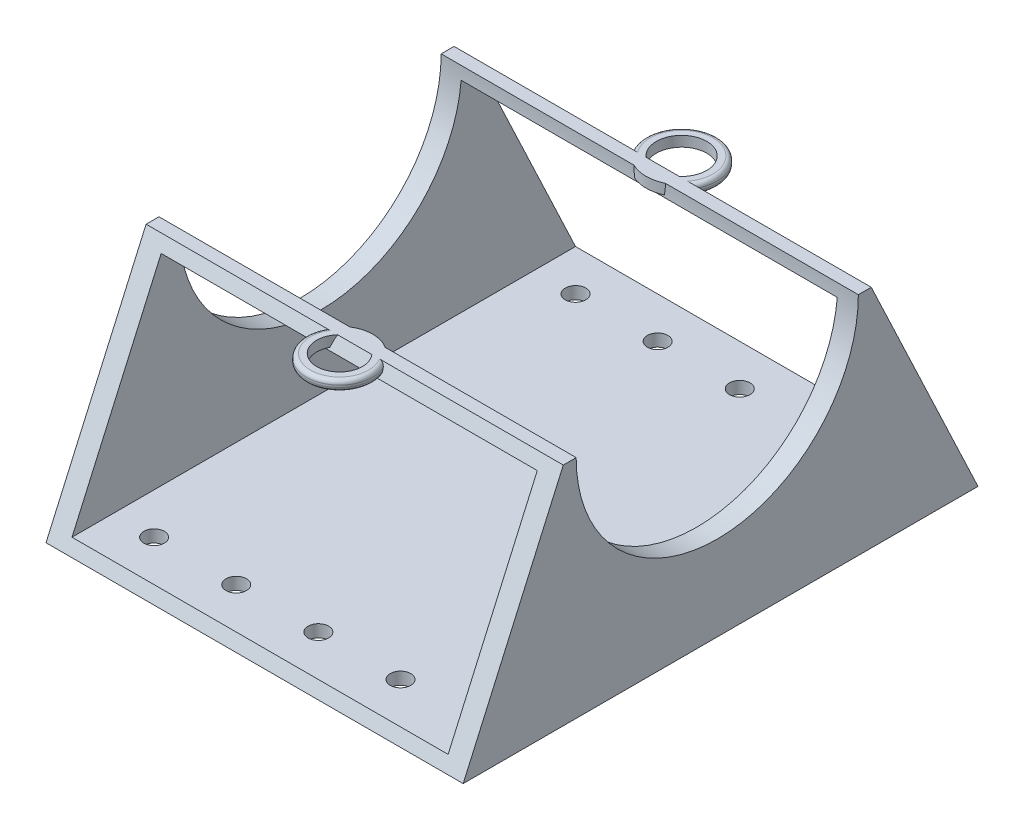
from build123d import *

# Parameters (mm, degrees)
SKETCH3_W               = 101.6
SKETCH3_H               = 75
BOSS_EXTRUDE2_DEPTH     = 55
CUT_EXTRUDE2_DEPTH      = 122.465262524
CUT_EXTRUDE2_DEPTH_BACK = 122.465262524
SKETCH4_R               = 34.361552214
BOSS_EXTRUDE4_DEPTH     = 101.6
BOSS_EXTRUDE5_DEPTH     = 101.6
CUT_EXTRUDE3_DEPTH      = 125.423596536
CUT_EXTRUDE3_DEPTH_BACK = 125.423596536
SKETCH9_W               = 91.6
SKETCH9_H               = 49
SKETCH11_R              = 8.637348936
SKETCH11_R_2            = 6.137348936
BOSS_EXTRUDE6_DEPTH     = 2.5
FILLET2_R               = 1
BOSS_EXTRUDE7_START     = -2.5
BOSS_EXTRUDE7_DEPTH     = 2.5
FILLET3_R               = 1
CUT_EXTRUDE4_START      = -10
SKETCH13_R              = 2.5
CUT_EXTRUDE4_DEPTH      = 12.5
CUT_EXTRUDE5_START      = -7.5
SKETCH14_R              = 2.5
CUT_EXTRUDE5_DEPTH      = 10
LPATTERN2_COUNT         = 4
LPATTERN2_PITCH         = 20
LPATTERN3_COUNT         = 4
LPATTERN3_PITCH         = 20


with BuildPart() as part:
    # Sketch3 → Boss-Extrude2 (new body)
    with BuildSketch(Plane(origin=(0, 0, 0), x_dir=(1, 0, 0), z_dir=(0, 1, 0))):
        Rectangle(SKETCH3_W, SKETCH3_H)
    extrude(amount=BOSS_EXTRUDE2_DEPTH)

    # Sketch4 → Cut-Extrude2 (cut, two sides: drawn at the far end of the back side and taken through both)
    with BuildSketch(Plane(origin=(50.8, 0, 0), x_dir=(0, 0, -1), z_dir=(1, 0, 0)).offset(-CUT_EXTRUDE2_DEPTH_BACK)):
        with Locations((0, 55)):
            Circle(SKETCH4_R)
    extrude(amount=CUT_EXTRUDE2_DEPTH + CUT_EXTRUDE2_DEPTH_BACK, mode=Mode.SUBTRACT)

    # Sketch7 → Boss-Extrude4 (add)
    with BuildSketch(Plane.ZY.offset(50.8)):
        Polygon((-37.5, 55), (-63.5, 0), (-37.5, 0), align=None)
    extrude(amount=-BOSS_EXTRUDE4_DEPTH)

    # Sketch8 → Boss-Extrude5 (add)
    with BuildSketch(Plane.ZY.offset(50.8)):
        Polygon((37.5, 55), (61.876010058, 0), (37.5, 0), align=None)
    extrude(amount=-BOSS_EXTRUDE5_DEPTH)

    # Sketch9 → Cut-Extrude3 (cut, two sides: drawn at the far end of the back side and taken through both)
    with BuildSketch(Plane(origin=(0, 0, -37.5), x_dir=(-1, 0, 0), z_dir=(0, 0, -1)).offset(-CUT_EXTRUDE3_DEPTH_BACK)):
        with Locations((0, 27.5)):
            Rectangle(SKETCH9_W, SKETCH9_H)
    extrude(amount=CUT_EXTRUDE3_DEPTH + CUT_EXTRUDE3_DEPTH_BACK, mode=Mode.SUBTRACT)

    # Sketch11 → Boss-Extrude6 (add)
    with BuildSketch(Plane(origin=(0, 55, 0), x_dir=(1, 0, 0), z_dir=(0, 1, 0))):
        with Locations((0, 42.107585669)):
            Circle(SKETCH11_R)
        with Locations((0, 42.107585669)):
            Circle(SKETCH11_R_2, mode=Mode.SUBTRACT)
    extrude(amount=-BOSS_EXTRUDE6_DEPTH)

    # Fillet2
    # the kernel refuses this fillet: 1 mm, written as the material it takes off along each edge
    with BuildSketch(Plane(origin=(0, 52.5, -42.107585669), x_dir=(0.7661198217735417, 0, 0.6426977662056067), z_dir=(-0.6426977662056067, 0, 0.7661198217735417))) as fillet2_piece_1_section:
        with BuildLine():
            CenterArc((8.637348936 - FILLET2_R, FILLET2_R), FILLET2_R, 270, 90)
            Line((8.637348936, FILLET2_R), (8.637348936, 0))
            Line((8.637348936, 0), (8.637348936 - FILLET2_R, 0))
        make_face()
    fillet2_piece_1 = revolve(axis=Axis((0, 52.5, -42.107585669), (0, 1, 0)), revolution_arc=259.986561096, mode=Mode.PRIVATE)
    fillet2_piece_1 = split(fillet2_piece_1, bisect_by=Plane(origin=(0, 51.176344905, -39.307546045), z_dir=(0, 0.42737961689341614, -0.9040722665053037)), keep=Keep.TOP, mode=Mode.PRIVATE)
    add(fillet2_piece_1, mode=Mode.SUBTRACT)
    with BuildSketch(Plane(origin=(0, 55, -42.107585669), x_dir=(0.6577465140217427, 0, 0.753239353255156), z_dir=(-0.753239353255156, 0, 0.6577465140217427))) as fillet2_piece_2_section:
        with BuildLine():
            CenterArc((8.637348936 - FILLET2_R, -FILLET2_R), FILLET2_R, 0, 90)
            Line((8.637348936 - FILLET2_R, 0), (8.637348936, 0))
            Line((8.637348936, 0), (8.637348936, -FILLET2_R))
        make_face()
    fillet2_piece_2 = revolve(axis=Axis((0, 55, -42.107585669), (0, 1, 0)), revolution_arc=277.743530493, mode=Mode.PRIVATE)
    fillet2_piece_2 = split(fillet2_piece_2, bisect_by=Plane(origin=(0, 53.219711563, -38.341590898), z_dir=(0, 0.42737961689341614, -0.9040722665053037)), keep=Keep.TOP, mode=Mode.PRIVATE)
    add(fillet2_piece_2, mode=Mode.SUBTRACT)

    # Boss-Extrude7: read off the stored shape, not the designer's step
    # Boss-Extrude7 outline → Boss-Extrude7 (add)
    with BuildSketch(Plane(origin=(0, 55, 0), x_dir=(1, 0, 0), z_dir=(0, 1, 0)).offset(BOSS_EXTRUDE7_START)):
        with BuildLine():
            Line((-50.8, -34.361552214), (-50.8, -37.5))
            Line((-50.8, -37.5), (-7.182675213, -37.5))
            ThreePointArc((-7.182675213, -37.5), (0, -49.257807046), (7.182675213, -37.5))
            Line((7.182675213, -37.5), (50.8, -37.5))
            Line((50.8, -37.5), (50.8, -34.361552214))
            Line((50.8, -34.361552214), (4.313996334, -34.361552214))
            ThreePointArc((4.313996334, -34.361552214), (0, -33.11220702), (-4.313996334, -34.361552214))
            Line((-4.313996334, -34.361552214), (-50.8, -34.361552214))
        make_face()
        with BuildLine():
            ThreePointArc((4.180529051, -37.5), (0, -46.757807046), (-4.180529051, -37.5))
            Line((-4.180529051, -37.5), (4.180529051, -37.5))
        make_face(mode=Mode.SUBTRACT)
    extrude(amount=BOSS_EXTRUDE7_DEPTH)

    # Fillet3
    # the kernel refuses this fillet: 1 mm, written as the material it takes off along each edge
    with BuildSketch(Plane(origin=(0, 52.5, 41.185007033), x_dir=(-0.8048848647873229, 0, -0.5934310022540891), z_dir=(0.5934310022540891, 0, -0.8048848647873229))) as fillet3_piece_1_section:
        with BuildLine():
            CenterArc((8.072800013 - FILLET3_R, FILLET3_R), FILLET3_R, 270, 90)
            Line((8.072800013 - FILLET3_R, 0), (8.072800013, 0))
            Line((8.072800013, 0), (8.072800013, FILLET3_R))
        make_face()
    fillet3_piece_1 = revolve(axis=Axis((0, 52.5, 41.185007033), (0, 1, 0)), revolution_arc=252.801724897, mode=Mode.PRIVATE)
    fillet3_piece_1 = split(fillet3_piece_1, bisect_by=Plane(origin=(0, 51.545382329, 39.031087184), z_dir=(0, 0.4051883376708072, 0.9142332366609561)), keep=Keep.TOP, mode=Mode.PRIVATE)
    add(fillet3_piece_1, mode=Mode.SUBTRACT)
    with BuildSketch(Plane(origin=(0, 55, 41.185007033), x_dir=(-0.7077045492924725, 0, -0.7065085073166059), z_dir=(0.7065085073166059, 0, -0.7077045492924725))) as fillet3_piece_2_section:
        with BuildLine():
            CenterArc((8.072800013 - FILLET3_R, -FILLET3_R), FILLET3_R, 0, 90)
            Line((8.072800013, -FILLET3_R), (8.072800013, 0))
            Line((8.072800013, 0), (8.072800013 - FILLET3_R, 0))
        make_face()
    fillet3_piece_2 = revolve(axis=Axis((0, 55, 41.185007033), (0, 1, 0)), revolution_arc=269.903086539, mode=Mode.PRIVATE)
    fillet3_piece_2 = split(fillet3_piece_2, bisect_by=Plane(origin=(0, 53.634938356, 38.10499557), z_dir=(0, 0.4051883376708072, 0.9142332366609561)), keep=Keep.TOP, mode=Mode.PRIVATE)
    add(fillet3_piece_2, mode=Mode.SUBTRACT)

    # Sketch13 → Cut-Extrude4 (cut)
    with BuildSketch(Plane(origin=(0, 3, 0), x_dir=(1, 0, 0), z_dir=(0, 1, 0)).offset(CUT_EXTRUDE4_START)):
        with Locations(Location((-35.8, -50.546409509, 0), (0, 0, 90))):
            Circle(SKETCH13_R)
    cut_extrude4 = extrude(amount=CUT_EXTRUDE4_DEPTH, mode=Mode.SUBTRACT)

    # Sketch14 → Cut-Extrude5 (cut)
    with BuildSketch(Plane(origin=(0, 3, 0), x_dir=(1, 0, 0), z_dir=(0, 1, 0)).offset(CUT_EXTRUDE5_START)):
        with Locations(Location((-35.8, 52.081818182, 0), (0, 0, 90))):
            Circle(SKETCH14_R)
    cut_extrude5 = extrude(amount=CUT_EXTRUDE5_DEPTH, mode=Mode.SUBTRACT)

    # LPattern2: Cut-Extrude4 ×4
    with Locations(*[(i * LPATTERN2_PITCH, 0, 0) for i in range(1, LPATTERN2_COUNT)]):
        add(cut_extrude4, mode=Mode.SUBTRACT)

    # LPattern3: Cut-Extrude5 ×4
    with Locations(*[(i * LPATTERN3_PITCH, 0, 0) for i in range(1, LPATTERN3_COUNT)]):
        add(cut_extrude5, mode=Mode.SUBTRACT)


solid = part.part
